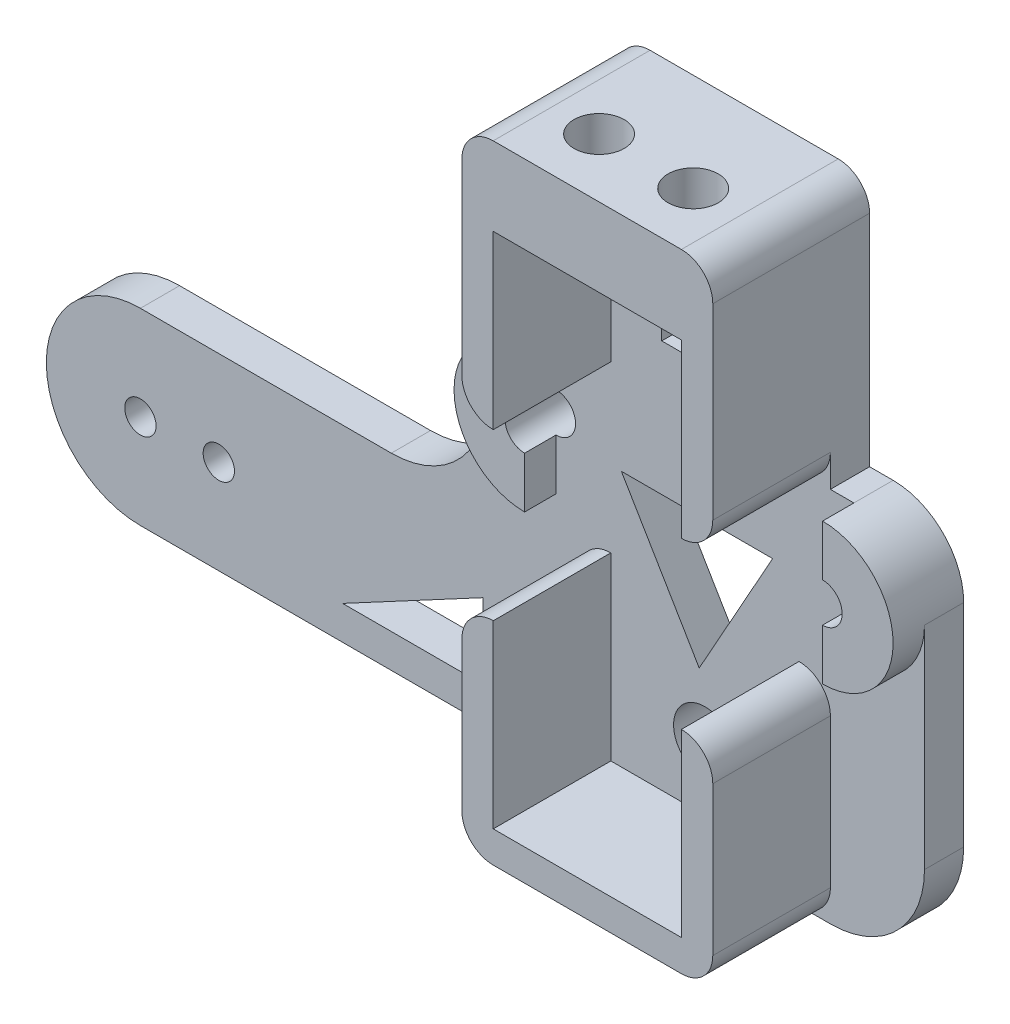
from build123d import *

# Parameters (mm, degrees)
SKETCH_1_R          = 1.25
SKETCH_1_R_2        = 1
SKETCH_1_R_3        = 2
EXTRUDE_1_DEPTH     = 2.5
EXTRUDE_2_DEPTH     = 10
EXTRUDE_START       = 2.5
EXTRUDE_4_DEPTH     = 2
FILLET_1_R          = 1
FILLET_2_R          = 6
EXTRUDE_START_2     = 7.5
SKETCH_2_W          = 2
SKETCH_2_H          = 16
EXTRUDE_5_DEPTH     = 7.5
SKETCH_3_W          = 7.5
SKETCH_3_H          = 5
EXTRUDE_6_DEPTH     = 14
SKETCH_4_R          = 1.6
CUT_EXTRUDE_1_DEPTH = 10
CUT_EXTRUDE_2_DEPTH = 10
CUT_EXTRUDE_3_DEPTH = 10
SKETCH_7_W          = 16
SKETCH_7_H          = 2.5
EXTRUDE_7_DEPTH     = 16
SKETCH_8_W          = 16
SKETCH_8_H          = 10.551633207
CUT_EXTRUDE_4_DEPTH = 7.5
CUT_EXTRUDE_5_DEPTH = 10
FILLET_3_R          = 2


with BuildPart() as part:
    # 草图1 → 凸台-拉伸1 (new body)
    with BuildSketch(Plane.XY):
        with BuildLine():
            Line((22, 6), (0, 6))
            ThreePointArc((0, 6), (-6, 0), (0, -6))
            Line((0, -6), (50, -6))
            Line((50, -6), (50, 13.5))
            ThreePointArc((50, 13.5), (48.681980515, 16.681980515), (45.5, 18))
            Line((45.5, 18), (26.5, 18))
            ThreePointArc((26.5, 18), (23.318019485, 16.681980515), (22, 13.5))
            Line((22, 13.5), (22, 6))
        make_face()
        with Locations((45.5, 13.5)):
            Circle(SKETCH_1_R, mode=Mode.SUBTRACT)
        with Locations((26.5, 13.5)):
            Circle(SKETCH_1_R, mode=Mode.SUBTRACT)
        Circle(SKETCH_1_R_2, mode=Mode.SUBTRACT)
        with Locations((5, 0)):
            Circle(SKETCH_1_R_2, mode=Mode.SUBTRACT)
        with Locations((36, 0)):
            Circle(SKETCH_1_R_3, mode=Mode.SUBTRACT)
    extrude(amount=EXTRUDE_1_DEPTH)

    # 草图1<3> → 凸台-拉伸2 (add)
    with BuildSketch(Plane.XY):
        Polygon((28, 9), (28, 6), (28, -6), (44, -6), (44, 9), (42, 9), (42, -4), (30, -4), (30, 9), align=None)
    extrude(amount=EXTRUDE_2_DEPTH)

    # 草图1<5> → 凸台-拉伸4 (add)
    with BuildSketch(Plane.XY.offset(EXTRUDE_START)):
        with BuildLine():
            ThreePointArc((26.5, 18), (22, 13.5), (26.5, 9))
            Line((26.5, 9), (26.5, 12.25))
            ThreePointArc((26.5, 12.25), (25.25, 13.5), (26.5, 14.75))
            Line((26.5, 14.75), (26.5, 18))
        make_face()
        with BuildLine():
            Line((45.5, 12.25), (45.5, 9))
            ThreePointArc((45.5, 9), (50, 13.5), (45.5, 18))
            Line((45.5, 18), (45.5, 14.75))
            ThreePointArc((45.5, 14.75), (46.75, 13.5), (45.5, 12.25))
        make_face()
    extrude(amount=EXTRUDE_4_DEPTH)

    # 圆角1
    fillet_1_edges = [part.edges().sort_by_distance(p)[0] for p in [
        (42, 9, 6.25),
        (30, 9, 6.25),
    ]]
    fillet(fillet_1_edges, radius=FILLET_1_R)

    # 圆角2
    fillet_2_edges = [part.edges().sort_by_distance(p)[0] for p in [
        (50, -6, 1.25),
        (22, 6, 1.25),
    ]]
    fillet(fillet_2_edges, radius=FILLET_2_R)

    # 草图2 → 凸台-拉伸5 (add)
    with BuildSketch(Plane.XY.offset(2.5).offset(EXTRUDE_START_2)):
        with Locations((43, 26)):
            Rectangle(SKETCH_2_W, SKETCH_2_H)
        with BuildLine():
            Line((43, 9), (44, 9))
            Line((44, 9), (44, 18))
            Line((44, 18), (42, 18))
            Line((42, 18), (42, 8))
            ThreePointArc((42, 8), (42.292893219, 8.707106781), (43, 9))
        make_face()
        with BuildLine():
            Line((28, 18), (28, 9))
            Line((28, 9), (29, 9))
            ThreePointArc((29, 9), (29.707106781, 8.707106781), (30, 8))
            Line((30, 8), (30, 18))
            Line((30, 18), (28, 18))
        make_face()
        with Locations((29, 26)):
            Rectangle(SKETCH_2_W, SKETCH_2_H)
    extrude(amount=-EXTRUDE_5_DEPTH)

    # 草图3 → 凸台-拉伸6 (add)
    with BuildSketch(Plane.ZY.offset(-28)):
        with Locations((6.25, 31.5)):
            Rectangle(SKETCH_3_W, SKETCH_3_H)
    extrude(amount=-EXTRUDE_6_DEPTH)

    # 草图4 → 切除-拉伸1 (cut)
    with BuildSketch(Plane(origin=(0, 34, 0), x_dir=(1, 0, 0), z_dir=(0, 1, 0))):
        with Locations(Location((33, -6.25, 0), (0, 0, 270))):
            Circle(SKETCH_4_R)
        with Locations(Location((39, -6.25, 0), (0, 0, 270))):
            Circle(SKETCH_4_R)
    extrude(amount=-CUT_EXTRUDE_1_DEPTH, mode=Mode.SUBTRACT)

    # 草图5 → 切除-拉伸2 (cut)
    with BuildSketch(Plane(origin=(0, 0, 0), x_dir=(-1, 0, 0), z_dir=(0, 0, -1))):
        Polygon((-30.670698378, 12.335500495), (-40.317654114, 12.335500495), (-35.634644198, 3.950389209), align=None)
    extrude(amount=-CUT_EXTRUDE_2_DEPTH, mode=Mode.SUBTRACT)

    # 草图6 → 切除-拉伸3 (cut)
    with BuildSketch(Plane(origin=(0, 0, 0), x_dir=(-1, 0, 0), z_dir=(0, 0, -1))):
        Polygon((-21.861162721, 0.94929577), (-21.861162721, -3.850507305), (-12.896241274, -3.850507305), align=None)
    extrude(amount=-CUT_EXTRUDE_3_DEPTH, mode=Mode.SUBTRACT)

    # 草图7 → 凸台-拉伸7 (add)
    with BuildSketch(Plane(origin=(0, 18, 0), x_dir=(1, 0, 0), z_dir=(0, 1, 0))):
        with Locations((36, -1.25)):
            Rectangle(SKETCH_7_W, SKETCH_7_H)
    extrude(amount=EXTRUDE_7_DEPTH)

    # 草图8 → 切除-拉伸4 (cut)
    with BuildSketch(Plane.XY.offset(10)):
        with Locations((36, 12.770298386)):
            Rectangle(SKETCH_8_W, SKETCH_8_H)
    extrude(amount=-CUT_EXTRUDE_4_DEPTH, mode=Mode.SUBTRACT)

    # 草图9 → 切除-拉伸5 (cut)
    with BuildSketch(Plane.XY.offset(2.5)):
        Polygon((33.245819602, 20.82286057), (40.232309823, 20.82286057), (33.245819602, 27.737325118), align=None)
    extrude(amount=-CUT_EXTRUDE_5_DEPTH, mode=Mode.SUBTRACT)

    # 圆角3
    fillet_3_edges = [part.edges().sort_by_distance(p)[0] for p in [
        (44, 34, 5),
        (28, 34, 5),
        (28, 18.046114989, 6.25),
        (28, 7.494481782, 6.25),
        (44, 18.046114989, 6.25),
        (44, 7.494481782, 6.25),
        (28, -6, 6.25),
        (44, -6, 6.25),
    ]]
    fillet(fillet_3_edges, radius=FILLET_3_R - 0.0001)  # a hair under: the kernel refuses the full size


solid = part.part
